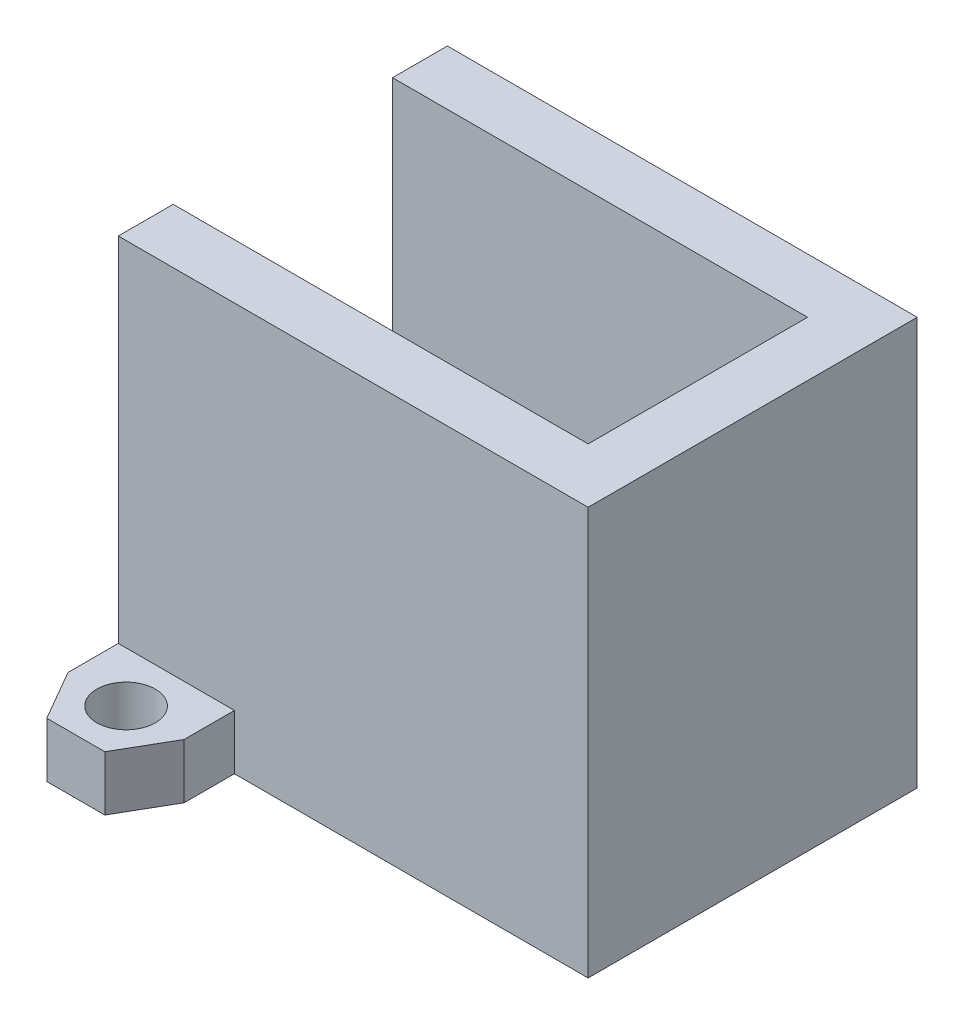
from build123d import *

# Parameters (mm, degrees)
SKETCH1_R             = 1.6
BOSS_EXTRUDE1_DEPTH   = 3
BOSS_EXTRUDE1_2_DEPTH = 3
BOSS_EXTRUDE2_DEPTH   = 22.3


with BuildPart() as part:
    # Sketch1 → Boss-Extrude1 (new body)
    with BuildSketch(Plane(origin=(0, 0, 0), x_dir=(1, 0, 0), z_dir=(0, 1, 0))):
        Polygon((-11.35, 11.75), (-11.35, 9), (-4.999147039, 9), (-4.999147039, 11.75), (-6.586860279, 14.5), (-9.76228676, 14.5), align=None)
        with Locations((-8.174573519, 11.75)):
            Circle(SKETCH1_R, mode=Mode.SUBTRACT)
    extrude(amount=BOSS_EXTRUDE1_DEPTH)



with BuildPart() as body_2:
    # Sketch1 → Boss-Extrude1 2 (new body)
    with BuildSketch(Plane(origin=(0, 0, 0), x_dir=(1, 0, 0), z_dir=(0, 1, 0))):
        Polygon((-11.35, -9), (-11.35, -11.75), (-9.76228676, -14.5), (-6.586860279, -14.5), (-4.999147039, -11.75), (-4.999147039, -9), align=None)
        with Locations((-8.174573519, -11.75)):
            Circle(SKETCH1_R, mode=Mode.SUBTRACT)
    extrude(amount=BOSS_EXTRUDE1_2_DEPTH)


with BuildPart() as part_1:
    add(part.part)

    add(body_2.part)  # Boss-Extrude2 merges body 2
    # Sketch1<3> → Boss-Extrude2 (add)
    with BuildSketch(Plane(origin=(0, 0, 0), x_dir=(1, 0, 0), z_dir=(0, 1, 0))):
        Polygon((-9.76228676, 9), (-11.35, 9), (-11.35, 6), (11.35, 6), (11.35, -6), (-11.35, -6), (-11.35, -9), (-9.76228676, -9), (-6.586860279, -9), (-4.999147039, -9), (14.35, -9), (14.35, 9), (-4.999147039, 9), (-6.586860279, 9), align=None)
    extrude(amount=BOSS_EXTRUDE2_DEPTH)


solid = part_1.part
